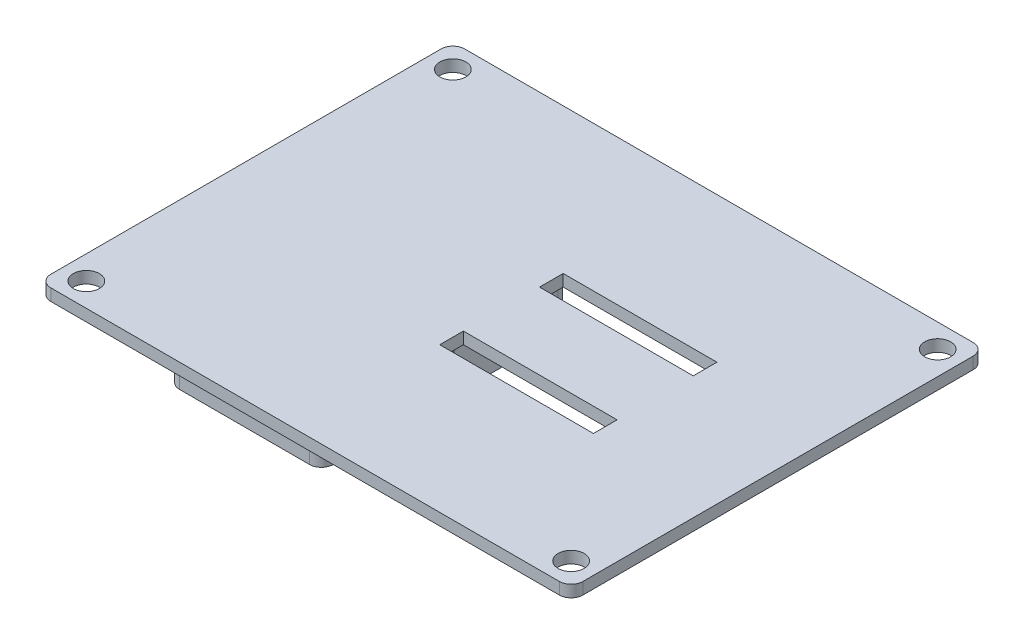
from build123d import *

# Parameters (mm, degrees)
SKETCH1_W                    = 114.3
SKETCH1_H                    = 88.9
BOSS_EXTRUDE2_DEPTH          = 2.54
SKETCH2_R                    = 2.794
CUT_EXTRUDE1_DEPTH           = 5.08
SKETCH9_W                    = 33.02
SKETCH9_H                    = 5.08
CUT_EXTRUDE5_DEPTH           = 6.35
SKETCH8_W                    = 33.02
SKETCH8_H                    = 53.34
BOSS_EXTRUDE4_DEPTH          = 21.59
SHELL4_T                     = -2.54
SKETCH13_W                   = 24.612851837
SKETCH13_H                   = 14.097856124
CUT_EXTRUDE6_DEPTH           = 5.08
FILLET5_R                    = 2.54
FILLET6_R                    = 2.54
FILLET7_R                    = 2.54
FILLET8_R                    = 2.54
FILLET1_R                    = 2.54
FILLET2_R                    = 2.54
FILLET3_R                    = 2.54
FILLET4_R                    = 2.54
FILLET9_R                    = 2.54
FILLET10_R                   = 2.54
FILLET11_R                   = 2.54
FILLET12_R                   = 2.54
SKETCH17_R                   = 3.175
BOSS_EXTRUDE5_DEPTH          = 7.62
SKETCH18_R                   = 1.651
CUT_EXTRUDE7_DEPTH           = 5.08
CUT_EXTRUDE7_DRAFT           = -2
CUT_EXTRUDE7_PROFILE_2_DEPTH = 5.08
CUT_EXTRUDE7_PROFILE_2_DRAFT = -2
CUT_EXTRUDE7_PROFILE_3_DEPTH = 5.08
CUT_EXTRUDE7_PROFILE_3_DRAFT = -2
CUT_EXTRUDE7_PROFILE_4_DEPTH = 5.08
CUT_EXTRUDE7_PROFILE_4_DRAFT = -2


with BuildPart() as part:
    # Sketch1 → Boss-Extrude2 (new body)
    with BuildSketch(Plane(origin=(0, 0, 0), x_dir=(1, 0, 0), z_dir=(0, 1, 0))):
        Rectangle(SKETCH1_W, SKETCH1_H)
    extrude(amount=BOSS_EXTRUDE2_DEPTH)

    # Sketch2 → Cut-Extrude1 (cut)
    with BuildSketch(Plane(origin=(0, 0, 0), x_dir=(-1, 0, 0), z_dir=(0, -1, 0))):
        with Locations((52.07, 39.37)):
            Circle(SKETCH2_R)
        with Locations((52.07, -39.37)):
            Circle(SKETCH2_R)
        with Locations((-52.07, -39.37)):
            Circle(SKETCH2_R)
        with Locations((-52.07, 39.37)):
            Circle(SKETCH2_R)
    extrude(amount=-CUT_EXTRUDE1_DEPTH, mode=Mode.SUBTRACT)

    # Sketch9 → Cut-Extrude5 (cut)
    with BuildSketch(Plane(origin=(0, 0, 0), x_dir=(-1, 0, 0), z_dir=(0, -1, 0))):
        with Locations((-14.245526461, -10.719909337)):
            Rectangle(SKETCH9_W, SKETCH9_H)
        with Locations((-14.245526461, 10.719909337)):
            Rectangle(SKETCH9_W, SKETCH9_H)
    extrude(amount=-CUT_EXTRUDE5_DEPTH, mode=Mode.SUBTRACT)

    # Fillet1
    fillet1_edges = [part.edges().sort_by_distance(p)[0] for p in [
        (57.15, 1.27, 44.45),
    ]]
    fillet(fillet1_edges, radius=FILLET1_R)

    # Fillet2
    fillet2_edges = [part.edges().sort_by_distance(p)[0] for p in [
        (-57.15, 1.27, -44.45),
    ]]
    fillet(fillet2_edges, radius=FILLET2_R)

    # Fillet3
    fillet3_edges = [part.edges().sort_by_distance(p)[0] for p in [
        (-57.15, 1.27, 44.45),
    ]]
    fillet(fillet3_edges, radius=FILLET3_R)

    # Fillet4
    fillet4_edges = [part.edges().sort_by_distance(p)[0] for p in [
        (57.15, 1.27, -44.45),
    ]]
    fillet(fillet4_edges, radius=FILLET4_R)

    # Sketch17 → Boss-Extrude5 (add)
    with BuildSketch(Plane(origin=(0, 0, 0), x_dir=(-1, 0, 0), z_dir=(0, -1, 0))):
        with Locations((8.645141255, -8.255)):
            Circle(SKETCH17_R)
        with Locations((8.645141255, 37.465)):
            Circle(SKETCH17_R)
        with Locations((-37.074858745, 37.465)):
            Circle(SKETCH17_R)
        with Locations((-37.074858745, -8.255)):
            Circle(SKETCH17_R)
    extrude(amount=BOSS_EXTRUDE5_DEPTH)


with BuildPart() as body_2:
    # Sketch8 → Boss-Extrude4 (new body)
    with BuildSketch(Plane(origin=(0, 0, 0), x_dir=(-1, 0, 0), z_dir=(0, -1, 0))):
        with Locations((32.055940653, 1.27)):
            Rectangle(SKETCH8_W, SKETCH8_H)
    extrude(amount=BOSS_EXTRUDE4_DEPTH)

    # Shell4
    shell4_openings = [body_2.faces().sort_by_distance(p)[0] for p in [
        (-32.055940653, -21.59, -1.27),
    ]]
    offset(amount=SHELL4_T, openings=shell4_openings, kind=Kind.INTERSECTION)

    # Sketch13 → Cut-Extrude6 (cut)
    with BuildSketch(Plane(origin=(0, 0, -27.94), x_dir=(-1, 0, 0), z_dir=(0, 0, -1))):
        with Locations((32.055940652, -10.795)):
            Rectangle(SKETCH13_W, SKETCH13_H)
    extrude(amount=-CUT_EXTRUDE6_DEPTH, mode=Mode.SUBTRACT)

    # Fillet5
    fillet5_edges = [body_2.edges().sort_by_distance(p)[0] for p in [
        (-19.749514734, -17.843928062, -26.67),
    ]]
    fillet(fillet5_edges, radius=FILLET5_R)

    # Fillet6
    fillet6_edges = [body_2.edges().sort_by_distance(p)[0] for p in [
        (-19.749514734, -3.746071938, -26.67),
    ]]
    fillet(fillet6_edges, radius=FILLET6_R)

    # Fillet7
    fillet7_edges = [body_2.edges().sort_by_distance(p)[0] for p in [
        (-44.362366571, -3.746071938, -26.67),
    ]]
    fillet(fillet7_edges, radius=FILLET7_R)

    # Fillet8
    fillet8_edges = [body_2.edges().sort_by_distance(p)[0] for p in [
        (-44.362366571, -17.843928062, -26.67),
    ]]
    fillet(fillet8_edges, radius=FILLET8_R)

    # Fillet9
    fillet9_edges = [body_2.edges().sort_by_distance(p)[0] for p in [
        (-15.545940653, -10.795, -27.94),
    ]]
    fillet(fillet9_edges, radius=FILLET9_R)

    # Fillet10
    fillet10_edges = [body_2.edges().sort_by_distance(p)[0] for p in [
        (-15.545940653, -10.795, 25.4),
    ]]
    fillet(fillet10_edges, radius=FILLET10_R)

    # Fillet11
    fillet11_edges = [body_2.edges().sort_by_distance(p)[0] for p in [
        (-48.565940653, -10.795, 25.4),
    ]]
    fillet(fillet11_edges, radius=FILLET11_R)

    # Fillet12
    fillet12_edges = [body_2.edges().sort_by_distance(p)[0] for p in [
        (-48.565940653, -10.795, -27.94),
    ]]
    fillet(fillet12_edges, radius=FILLET12_R)


with BuildPart() as cut_extrude7_tool:
    # Sketch18 → Cut-Extrude7 (with draft: the straight prism first)
    with BuildSketch(Plane.XZ.offset(7.62)):
        with Locations((37.074858745, 8.255)):
            Circle(SKETCH18_R)
    extrude(amount=-CUT_EXTRUDE7_DEPTH)
    # Cut-Extrude7: the draft: its side faces are tilted about the plane it starts from
    cut_extrude7_sides = [cut_extrude7_tool.faces().sort_by_distance(p)[0] for p in [
        (35.423858745, -5.08, 8.255),
    ]]
    draft(cut_extrude7_sides, Plane.XZ.offset(7.62), CUT_EXTRUDE7_DRAFT)


with BuildPart() as part_1:
    add(part.part)

    # Cut-Extrude7: cut by cut_extrude7_tool
    add(cut_extrude7_tool.part, mode=Mode.SUBTRACT)


with BuildPart() as cut_extrude7_profile_2_tool:
    # Sketch18 → Cut-Extrude7 profile 2 (with draft: the straight prism first)
    with BuildSketch(Plane.XZ.offset(7.62)):
        with Locations((37.074858745, -37.465)):
            Circle(SKETCH18_R)
    extrude(amount=-CUT_EXTRUDE7_PROFILE_2_DEPTH)
    # Cut-Extrude7 profile 2: the draft: its side faces are tilted about the plane it starts from
    cut_extrude7_profile_2_sides = [cut_extrude7_profile_2_tool.faces().sort_by_distance(p)[0] for p in [
        (35.423858745, -5.08, -37.465),
    ]]
    draft(cut_extrude7_profile_2_sides, Plane.XZ.offset(7.62), CUT_EXTRUDE7_PROFILE_2_DRAFT)


with BuildPart() as part_2:
    add(part_1.part)

    # Cut-Extrude7 profile 2: cut by cut_extrude7_profile_2_tool
    add(cut_extrude7_profile_2_tool.part, mode=Mode.SUBTRACT)


with BuildPart() as cut_extrude7_profile_3_tool:
    # Sketch18 → Cut-Extrude7 profile 3 (with draft: the straight prism first)
    with BuildSketch(Plane.XZ.offset(7.62)):
        with Locations((-8.645141255, -37.465)):
            Circle(SKETCH18_R)
    extrude(amount=-CUT_EXTRUDE7_PROFILE_3_DEPTH)
    # Cut-Extrude7 profile 3: the draft: its side faces are tilted about the plane it starts from
    cut_extrude7_profile_3_sides = [cut_extrude7_profile_3_tool.faces().sort_by_distance(p)[0] for p in [
        (-10.296141255, -5.08, -37.465),
    ]]
    draft(cut_extrude7_profile_3_sides, Plane.XZ.offset(7.62), CUT_EXTRUDE7_PROFILE_3_DRAFT)


with BuildPart() as part_3:
    add(part_2.part)

    # Cut-Extrude7 profile 3: cut by cut_extrude7_profile_3_tool
    add(cut_extrude7_profile_3_tool.part, mode=Mode.SUBTRACT)


with BuildPart() as cut_extrude7_profile_4_tool:
    # Sketch18 → Cut-Extrude7 profile 4 (with draft: the straight prism first)
    with BuildSketch(Plane.XZ.offset(7.62)):
        with Locations((-8.645141255, 8.255)):
            Circle(SKETCH18_R)
    extrude(amount=-CUT_EXTRUDE7_PROFILE_4_DEPTH)
    # Cut-Extrude7 profile 4: the draft: its side faces are tilted about the plane it starts from
    cut_extrude7_profile_4_sides = [cut_extrude7_profile_4_tool.faces().sort_by_distance(p)[0] for p in [
        (-10.296141255, -5.08, 8.255),
    ]]
    draft(cut_extrude7_profile_4_sides, Plane.XZ.offset(7.62), CUT_EXTRUDE7_PROFILE_4_DRAFT)


with BuildPart() as part_4:
    add(part_3.part)

    # Cut-Extrude7 profile 4: cut by cut_extrude7_profile_4_tool
    add(cut_extrude7_profile_4_tool.part, mode=Mode.SUBTRACT)


solid = Compound([body_2.part, part_4.part])
